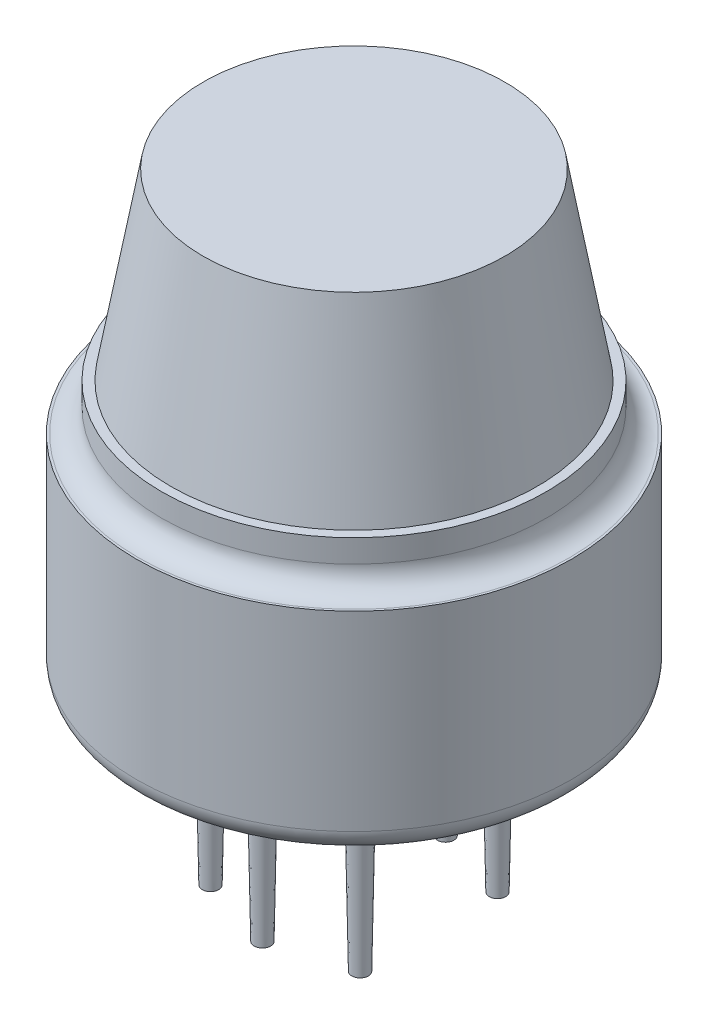
from build123d import *

# Parameters (mm, degrees)
SKETCH1_R                     = 9.5
BOSS_EXTRUDE1_DEPTH           = 9.2
SKETCH2_R                     = 8.4
BOSS_EXTRUDE2_DEPTH           = 2
SKETCH3_R                     = 8
CUT_EXTRUDE1_DEPTH            = 2
FILLET1_R                     = 1
SKETCH4_R                     = 8
BOSS_EXTRUDE3_DEPTH           = 8
BOSS_EXTRUDE3_TAPER           = 10
SKETCH5_R                     = 9
CUT_EXTRUDE2_DEPTH            = 0.5
SKETCH6_R                     = 0.5
BOSS_EXTRUDE4_DEPTH           = 8
BOSS_EXTRUDE4_DRAFT           = 1
BOSS_EXTRUDE4_PROFILE_2_DEPTH = 8
BOSS_EXTRUDE4_PROFILE_2_DRAFT = 1
BOSS_EXTRUDE4_PROFILE_3_DEPTH = 8
BOSS_EXTRUDE4_PROFILE_3_DRAFT = 1
BOSS_EXTRUDE4_PROFILE_4_DEPTH = 8
BOSS_EXTRUDE4_PROFILE_4_DRAFT = 1
BOSS_EXTRUDE4_PROFILE_5_DEPTH = 8
BOSS_EXTRUDE4_PROFILE_5_DRAFT = 1
BOSS_EXTRUDE4_PROFILE_6_DEPTH = 8
BOSS_EXTRUDE4_PROFILE_6_DRAFT = 1
FILLET2_R                     = 1
FILLET3_R                     = 0.1
SKETCH7_W                     = 0.26119124
SKETCH7_H                     = 1.852083333
CUT_EXTRUDE3_DEPTH            = 0.5


with BuildPart() as part:
    # Sketch1 → Boss-Extrude1 (new body)
    with BuildSketch(Plane(origin=(0, 0, 0), x_dir=(1, 0, 0), z_dir=(0, 1, 0))):
        with Locations(Location((0, 0, 0), (0, 0, 270))):
            Circle(SKETCH1_R)
    extrude(amount=BOSS_EXTRUDE1_DEPTH)

    # Sketch2 → Boss-Extrude2 (add)
    with BuildSketch(Plane(origin=(0, 9.2, 0), x_dir=(1, 0, 0), z_dir=(0, 1, 0))):
        with Locations(Location((0, 0, 0), (0, 0, 270))):
            Circle(SKETCH2_R)
    extrude(amount=BOSS_EXTRUDE2_DEPTH)

    # Sketch3 → Cut-Extrude1 (cut)
    with BuildSketch(Plane(origin=(0, 11.2, 0), x_dir=(1, 0, 0), z_dir=(0, 1, 0))):
        with Locations(Location((0, 0, 0), (0, 0, 270))):
            Circle(SKETCH3_R)
    extrude(amount=-CUT_EXTRUDE1_DEPTH, mode=Mode.SUBTRACT)

    # Fillet1
    fillet1_edges = [part.edges().sort_by_distance(p)[0] for p in [
        (0, 9.2, -8.4),
    ]]
    fillet(fillet1_edges, radius=FILLET1_R)

    # Sketch5 → Cut-Extrude2 (cut)
    with BuildSketch(Plane.XZ):
        with Locations(Location((0, 0, 0), (0, 0, 270))):
            Circle(SKETCH5_R)
    extrude(amount=-CUT_EXTRUDE2_DEPTH, mode=Mode.SUBTRACT)

    # Fillet2
    # the kernel refuses this fillet: 1 mm, written as the material it takes off along each edge
    with BuildSketch(Plane(origin=(0, 0, 0), x_dir=(0, 0, 1), z_dir=(-1, 0, 0))) as fillet2_piece_1:
        with BuildLine():
            CenterArc((8.5, 0.866025404), FILLET2_R, 300, 60)
            Line((9, 0), (9.01, -0.017320508))
            ThreePointArc((9.01, -0.017320508), (9.25, -0.02), (9.5, -0.02))
            Line((9.5, -0.02), (9.52, 0))
            Line((9.52, 0), (9.52, 0.866025404))
            Line((9.52, 0.866025404), (9.5, 0.866025404))
        make_face()
    revolve(axis=Axis((0, 0, 0), (0, 1, 0)), mode=Mode.SUBTRACT)

    # Fillet3
    fillet3_edges = [part.edges().sort_by_distance(p)[0] for p in [
        (0, 0.5, 9),
    ]]
    fillet(fillet3_edges, radius=FILLET3_R)

    # Sketch7 → Cut-Extrude3 (cut)
    with BuildSketch(Plane.XZ.offset(-0.5)):
        Polygon((-6.885950855, 1.852083333), (-6.614371327, 1.852083333), (-6.06676015, 0.522382479), (-5.276879257, 1.852083333), (-5.233471054, 1.852083333), (-4.452123397, 0.522382479), (-3.901173127, 1.852083333), (-3.632932692, 1.852083333), (-4.400181958, 0), (-4.436169955, 0), (-5.259441774, 1.400934829), (-6.091617839, 0), (-6.123153713, 0), align=None)
        with Locations((-2.979954594, 0.926041667)):
            Rectangle(SKETCH7_W, SKETCH7_H)
        Polygon((-2.208253205, 0), (-2.208253205, 1.852083333), (-2.153343683, 1.852083333), (-0.308680556, 0.421838692), (-0.308680556, 1.852083333), (-0.047489316, 1.852083333), (-0.047489316, 0), (-0.106850962, 0), (-1.947061966, 1.426534539), (-1.947061966, 0), align=None)
        with BuildLine():
            Line((0.356169872, 0.357282903), (0.58953534, 0.451148504))
            add(Edge.make_bspline(
                [(0.58953534, 0.451148504), (0.609496433, 0.42663848), (0.648244876, 0.37905966), (0.712105176, 0.316151094), (0.777959001, 0.262432), (0.846563265, 0.218713276), (0.917518982, 0.184510051), (0.990825816, 0.160283546), (1.066528602, 0.145161112), (1.117907785, 0.14337095), (1.143824703, 0.142467949)],
                knots=[0, 0, 0, 0, 1.152089572, 2.236434419, 3.262720936, 4.246162169, 5.196317325, 6.127660375, 7.055546052, 8, 8, 8, 8], degree=3))
            add(Edge.make_bspline(
                [(1.143824703, 0.142467949), (1.165989357, 0.142916086), (1.209731739, 0.143800494), (1.274131557, 0.152348705), (1.336523505, 0.165542887), (1.39593897, 0.18440222), (1.451280366, 0.20714845), (1.500112314, 0.234591344), (1.542044941, 0.265629174), (1.576712653, 0.300106216), (1.604036819, 0.337203688), (1.623486926, 0.375855643), (1.636473302, 0.415571747), (1.637745974, 0.442765173), (1.63838141, 0.456342648)],
                knots=[0, 0, 0, 0, 1.238349031, 2.443906286, 3.624874093, 4.798942716, 5.923617549, 6.963699705, 7.921824088, 8.83101724, 9.686901663, 10.484521922, 11.243333087, 12, 12, 12, 12], degree=3))
            add(Edge.make_bspline(
                [(1.63838141, 0.456342648), (1.637310008, 0.471838764), (1.635101116, 0.503786845), (1.61610366, 0.550331614), (1.586828646, 0.596231349), (1.560640155, 0.623608551), (1.54674187, 0.638137687)],
                knots=[0, 0, 0, 0, 0.887223272, 1.829173364, 2.84793798, 4, 4, 4, 4], degree=3))
            add(Edge.make_bspline(
                [(1.54674187, 0.638137687), (1.535255341, 0.648809916), (1.51080274, 0.671529029), (1.468944365, 0.704176717), (1.420870303, 0.738738326), (1.366498378, 0.77500325), (1.305284755, 0.812387304), (1.237823732, 0.851740219), (1.163653054, 0.892433296), (1.111723873, 0.919464605), (1.084834068, 0.933461872)],
                knots=[0, 0, 0, 0, 0.684072347, 1.456257804, 2.314658692, 3.268296586, 4.307941752, 5.444813601, 6.676881395, 8, 8, 8, 8], degree=3))
            add(Edge.make_bspline(
                [(1.084834068, 0.933461872), (1.058065554, 0.947331674), (1.006925033, 0.973829553), (0.934781208, 1.01330209), (0.870152066, 1.049072605), (0.813651809, 1.081957959), (0.765387033, 1.112261285), (0.724371949, 1.138579108), (0.691576663, 1.162422496), (0.673296078, 1.178344856), (0.665221438, 1.185377855)],
                knots=[0, 0, 0, 0, 1.475543639, 2.818986114, 4.02480104, 5.09096343, 6.018093619, 6.813867338, 7.476078347, 8, 8, 8, 8], degree=3))
            add(Edge.make_bspline(
                [(0.665221438, 1.185377855), (0.653902397, 1.1962033), (0.631932998, 1.217214668), (0.602906999, 1.250956339), (0.577589783, 1.284963665), (0.55779066, 1.320313454), (0.541697542, 1.355959237), (0.530648268, 1.392496686), (0.523670329, 1.429730723), (0.522811156, 1.454825051), (0.522382479, 1.46734567)],
                knots=[0, 0, 0, 0, 1.153424584, 2.23870947, 3.275830823, 4.271613903, 5.218145226, 6.15209119, 7.078000373, 8, 8, 8, 8], degree=3))
            add(Edge.make_bspline(
                [(0.522382479, 1.46734567), (0.522683682, 1.477254994), (0.523281095, 1.49690934), (0.527595765, 1.526068509), (0.534054071, 1.554741321), (0.544038137, 1.582491256), (0.555651596, 1.61000645), (0.571224263, 1.636097383), (0.588701284, 1.662057227), (0.616130541, 1.695822505), (0.657022054, 1.735306168), (0.714034361, 1.777448587), (0.780367663, 1.813273902), (0.85403239, 1.8441908), (0.934051962, 1.868495213), (1.018089621, 1.887016459), (1.105726597, 1.897282534), (1.165194692, 1.898801337), (1.195395132, 1.89957265)],
                knots=[0, 0, 0, 0, 0.539029401, 1.069121303, 1.601259569, 2.135436362, 2.671812815, 3.22354654, 3.785365854, 4.373914828, 5.587402901, 6.867381044, 8.219734826, 9.679516073, 11.207829841, 12.764024048, 14.356633122, 16, 16, 16, 16], degree=3))
            add(Edge.make_bspline(
                [(1.195395132, 1.89957265), (1.227590237, 1.898831183), (1.291244423, 1.897365202), (1.385065763, 1.884409089), (1.475568728, 1.86317933), (1.548777566, 1.838737613), (1.606093663, 1.814061569), (1.649725747, 1.792044293), (1.693788449, 1.766279219), (1.738821175, 1.737325688), (1.784298574, 1.704648196), (1.830450417, 1.668491054), (1.877127197, 1.628899797), (1.907718055, 1.600533725), (1.923317308, 1.58606896)],
                knots=[0, 0, 0, 0, 1.422078643, 2.811646575, 4.175598256, 5.525232754, 6.215510619, 6.931566771, 7.683268332, 8.469968427, 9.296431584, 10.156744404, 11.06006522, 12, 12, 12, 12], degree=3))
            Line((1.923317308, 1.58606896), (1.699227097, 1.472168803))
            add(Edge.make_bspline(
                [(1.699227097, 1.472168803), (1.686055795, 1.483864507), (1.660605719, 1.506463379), (1.62255593, 1.538208422), (1.585995654, 1.566763063), (1.55065896, 1.592048562), (1.516957959, 1.614265803), (1.484914406, 1.633812753), (1.454279165, 1.650250488), (1.415079939, 1.667394113), (1.366009395, 1.684867599), (1.305034447, 1.699144461), (1.241408118, 1.707911086), (1.198144531, 1.709040149), (1.176102597, 1.709615385)],
                knots=[0, 0, 0, 0, 1.074228015, 2.075663111, 3.021624324, 3.902793679, 4.724914158, 5.482914942, 6.191458127, 6.843165991, 8.090764799, 9.362211274, 10.656099381, 12, 12, 12, 12], degree=3))
            add(Edge.make_bspline(
                [(1.176102597, 1.709615385), (1.16200048, 1.709370183), (1.134506496, 1.70889213), (1.094081376, 1.70607551), (1.055817801, 1.70046904), (1.019438085, 1.692902883), (0.984894686, 1.684013682), (0.952569859, 1.671829709), (0.921937287, 1.658221831), (0.893632306, 1.64243281), (0.868161729, 1.625042534), (0.845593569, 1.606892479), (0.826525724, 1.587490294), (0.810667775, 1.567082675), (0.798773376, 1.545328779), (0.790062767, 1.522773616), (0.784712917, 1.499252291), (0.783954727, 1.483202375), (0.783573718, 1.475136886)],
                knots=[0, 0, 0, 0, 1.344780428, 2.621831248, 3.86091427, 5.028822096, 6.164433506, 7.257555437, 8.318398087, 9.358390499, 10.342883404, 11.256382275, 12.115274943, 12.931328421, 13.712469561, 14.47020682, 15.231240198, 16, 16, 16, 16], degree=3))
            add(Edge.make_bspline(
                [(0.783573718, 1.475136886), (0.783931802, 1.465188643), (0.784653629, 1.445134963), (0.792859606, 1.415684708), (0.804167979, 1.386230548), (0.821514684, 1.357219624), (0.844710972, 1.327467683), (0.876049906, 1.297824643), (0.914524401, 1.26649253), (0.943565557, 1.24650198), (0.959061582, 1.235835253)],
                knots=[0, 0, 0, 0, 0.76880994, 1.549768002, 2.354129864, 3.208810305, 4.157741603, 5.269146009, 6.542847899, 8, 8, 8, 8], degree=3))
            add(Edge.make_bspline(
                [(0.959061582, 1.235835253), (0.96497642, 1.232212827), (0.979107163, 1.223558733), (1.004588584, 1.20942959), (1.038063408, 1.192371982), (1.078783008, 1.170448004), (1.127701283, 1.145956596), (1.184303098, 1.117559286), (1.248719018, 1.085867708), (1.29421341, 1.063327222), (1.318199536, 1.051443142)],
                knots=[0, 0, 0, 0, 0.412210111, 0.984783423, 1.731088825, 2.645137316, 3.733213325, 4.982341228, 6.408991929, 8, 8, 8, 8], degree=3))
            add(Edge.make_bspline(
                [(1.318199536, 1.051443142), (1.347066182, 1.036826974), (1.402834888, 1.008589375), (1.482581582, 0.966161749), (1.555094955, 0.924593312), (1.620375581, 0.88417169), (1.67886611, 0.845348411), (1.730200479, 0.80754919), (1.774621539, 0.770952591), (1.812125053, 0.734927371), (1.844151818, 0.699737765), (1.871297142, 0.664577933), (1.894920861, 0.629874149), (1.913999664, 0.594856888), (1.928673385, 0.559654443), (1.938992987, 0.524437863), (1.945711548, 0.489120716), (1.946612355, 0.465523449), (1.947061966, 0.453745576)],
                knots=[0, 0, 0, 0, 1.709562351, 3.302776476, 4.772177714, 6.124901424, 7.359068972, 8.480380071, 9.491865779, 10.397660351, 11.22576364, 12.003453628, 12.742868209, 13.441670434, 14.106660575, 14.753818965, 15.378005873, 16, 16, 16, 16], degree=3))
            add(Edge.make_bspline(
                [(1.947061966, 0.453745576), (1.946494483, 0.437110501), (1.945364194, 0.403977412), (1.933935461, 0.355432268), (1.916433997, 0.308433292), (1.891517894, 0.263218184), (1.859718489, 0.219623409), (1.820736081, 0.177926924), (1.774628096, 0.138221069), (1.72249488, 0.100506125), (1.665309394, 0.065860037), (1.604416874, 0.035389163), (1.540473721, 0.009821621), (1.473481925, -0.011097345), (1.40349946, -0.027217142), (1.330528169, -0.039150173), (1.254531786, -0.046350722), (1.202831167, -0.047104852), (1.176473608, -0.047489316)],
                knots=[0, 0, 0, 0, 0.789167787, 1.571833384, 2.356547704, 3.16644455, 4.016223069, 4.914320835, 5.872282974, 6.903077527, 7.968268762, 9.045691288, 10.134668915, 11.236757733, 12.377033922, 13.543993062, 14.747899939, 16, 16, 16, 16], degree=3))
            add(Edge.make_bspline(
                [(1.176473608, -0.047489316), (1.156058204, -0.047223149), (1.115672927, -0.046696622), (1.055897537, -0.041933024), (0.997492132, -0.035238854), (0.940725064, -0.024575568), (0.885200018, -0.011678684), (0.831142008, 0.004172185), (0.778554604, 0.023294777), (0.727269629, 0.045075399), (0.677119826, 0.070482592), (0.628235351, 0.099860569), (0.580131028, 0.133039626), (0.533131595, 0.170187267), (0.486938242, 0.211076575), (0.442176791, 0.256113331), (0.398127647, 0.30483068), (0.370337327, 0.339571894), (0.356169872, 0.357282903)],
                knots=[0, 0, 0, 0, 1.029753048, 2.037033552, 3.023718286, 3.994153229, 4.94908124, 5.898674701, 6.834164454, 7.770548408, 8.708074864, 9.667861764, 10.645669405, 11.654185788, 12.688370985, 13.756003842, 14.856014769, 16, 16, 16, 16], degree=3))
        make_face()
        Polygon((2.516933761, 1.852083333), (4.060336538, 1.852083333), (4.060336538, 1.662126068), (2.778125, 1.662126068), (2.778125, 1.092254274), (4.060336538, 1.092254274), (4.060336538, 0.902297009), (2.778125, 0.902297009), (2.778125, 0.189957265), (4.060336538, 0.189957265), (4.060336538, 0), (2.516933761, 0), align=None)
        Polygon((4.558974359, 0), (4.558974359, 1.852083333), (4.613883881, 1.852083333), (6.458547009, 0.421838692), (6.458547009, 1.852083333), (6.719738248, 1.852083333), (6.719738248, 0), (6.660376603, 0), (4.820165598, 1.426534539), (4.820165598, 0), align=None)
    extrude(amount=-CUT_EXTRUDE3_DEPTH, mode=Mode.SUBTRACT)


with BuildPart() as body_2:
    # Sketch4 → Boss-Extrude3 (new body)
    with BuildSketch(Plane(origin=(0, 11.2, 0), x_dir=(1, 0, 0), z_dir=(0, 1, 0))):
        with Locations(Location((0, 0, 0), (0, 0, 270))):
            Circle(SKETCH4_R)
    extrude(amount=BOSS_EXTRUDE3_DEPTH, taper=BOSS_EXTRUDE3_TAPER)


with BuildPart() as body_3:
    # Sketch6 → Boss-Extrude4 (with draft: the straight prism first)
    with BuildSketch(Plane(origin=(0, 0, 0), x_dir=(-1, 0, 0), z_dir=(0, -1, 0))):
        with Locations((3.265498704, -3)):
            Circle(SKETCH6_R)
    extrude(amount=BOSS_EXTRUDE4_DEPTH)
    # Boss-Extrude4: the draft: its side faces are tilted about the plane it starts from
    boss_extrude4_sides = [body_3.faces().sort_by_distance(p)[0] for p in [
        (-2.765498704, -4, 3),
    ]]
    draft(boss_extrude4_sides, Plane(origin=(0, 0, 0), x_dir=(-1, 0, 0), z_dir=(0, -1, 0)), BOSS_EXTRUDE4_DRAFT)


with BuildPart() as body_4:
    # Sketch6 → Boss-Extrude4 profile 2 (with draft: the straight prism first)
    with BuildSketch(Plane(origin=(0, 0, 0), x_dir=(-1, 0, 0), z_dir=(0, -1, 0))):
        with Locations((-3.265498704, -3)):
            Circle(SKETCH6_R)
    extrude(amount=BOSS_EXTRUDE4_PROFILE_2_DEPTH)
    # Boss-Extrude4 profile 2: the draft: its side faces are tilted about the plane it starts from
    boss_extrude4_profile_2_sides = [body_4.faces().sort_by_distance(p)[0] for p in [
        (3.765498704, -4, 3),
    ]]
    draft(boss_extrude4_profile_2_sides, Plane(origin=(0, 0, 0), x_dir=(-1, 0, 0), z_dir=(0, -1, 0)), BOSS_EXTRUDE4_PROFILE_2_DRAFT)


with BuildPart() as body_5:
    # Sketch6 → Boss-Extrude4 profile 3 (with draft: the straight prism first)
    with BuildSketch(Plane(origin=(0, 0, 0), x_dir=(-1, 0, 0), z_dir=(0, -1, 0))):
        with Locations((0, -4)):
            Circle(SKETCH6_R)
    extrude(amount=BOSS_EXTRUDE4_PROFILE_3_DEPTH)
    # Boss-Extrude4 profile 3: the draft: its side faces are tilted about the plane it starts from
    boss_extrude4_profile_3_sides = [body_5.faces().sort_by_distance(p)[0] for p in [
        (0.5, -4, 4),
    ]]
    draft(boss_extrude4_profile_3_sides, Plane(origin=(0, 0, 0), x_dir=(-1, 0, 0), z_dir=(0, -1, 0)), BOSS_EXTRUDE4_PROFILE_3_DRAFT)


with BuildPart() as body_6:
    # Sketch6 → Boss-Extrude4 profile 4 (with draft: the straight prism first)
    with BuildSketch(Plane(origin=(0, 0, 0), x_dir=(-1, 0, 0), z_dir=(0, -1, 0))):
        with Locations((-3.265498704, 3)):
            Circle(SKETCH6_R)
    extrude(amount=BOSS_EXTRUDE4_PROFILE_4_DEPTH)
    # Boss-Extrude4 profile 4: the draft: its side faces are tilted about the plane it starts from
    boss_extrude4_profile_4_sides = [body_6.faces().sort_by_distance(p)[0] for p in [
        (3.765498704, -4, -3),
    ]]
    draft(boss_extrude4_profile_4_sides, Plane(origin=(0, 0, 0), x_dir=(-1, 0, 0), z_dir=(0, -1, 0)), BOSS_EXTRUDE4_PROFILE_4_DRAFT)


with BuildPart() as body_7:
    # Sketch6 → Boss-Extrude4 profile 5 (with draft: the straight prism first)
    with BuildSketch(Plane(origin=(0, 0, 0), x_dir=(-1, 0, 0), z_dir=(0, -1, 0))):
        with Locations((3.265498704, 3)):
            Circle(SKETCH6_R)
    extrude(amount=BOSS_EXTRUDE4_PROFILE_5_DEPTH)
    # Boss-Extrude4 profile 5: the draft: its side faces are tilted about the plane it starts from
    boss_extrude4_profile_5_sides = [body_7.faces().sort_by_distance(p)[0] for p in [
        (-2.765498704, -4, -3),
    ]]
    draft(boss_extrude4_profile_5_sides, Plane(origin=(0, 0, 0), x_dir=(-1, 0, 0), z_dir=(0, -1, 0)), BOSS_EXTRUDE4_PROFILE_5_DRAFT)


with BuildPart() as body_8:
    # Sketch6 → Boss-Extrude4 profile 6 (with draft: the straight prism first)
    with BuildSketch(Plane(origin=(0, 0, 0), x_dir=(-1, 0, 0), z_dir=(0, -1, 0))):
        with Locations((0, 4)):
            Circle(SKETCH6_R)
    extrude(amount=BOSS_EXTRUDE4_PROFILE_6_DEPTH)
    # Boss-Extrude4 profile 6: the draft: its side faces are tilted about the plane it starts from
    boss_extrude4_profile_6_sides = [body_8.faces().sort_by_distance(p)[0] for p in [
        (0.5, -4, -4),
    ]]
    draft(boss_extrude4_profile_6_sides, Plane(origin=(0, 0, 0), x_dir=(-1, 0, 0), z_dir=(0, -1, 0)), BOSS_EXTRUDE4_PROFILE_6_DRAFT)


solid = Compound([part.part, body_2.part, body_3.part, body_4.part, body_5.part, body_6.part, body_7.part, body_8.part])
